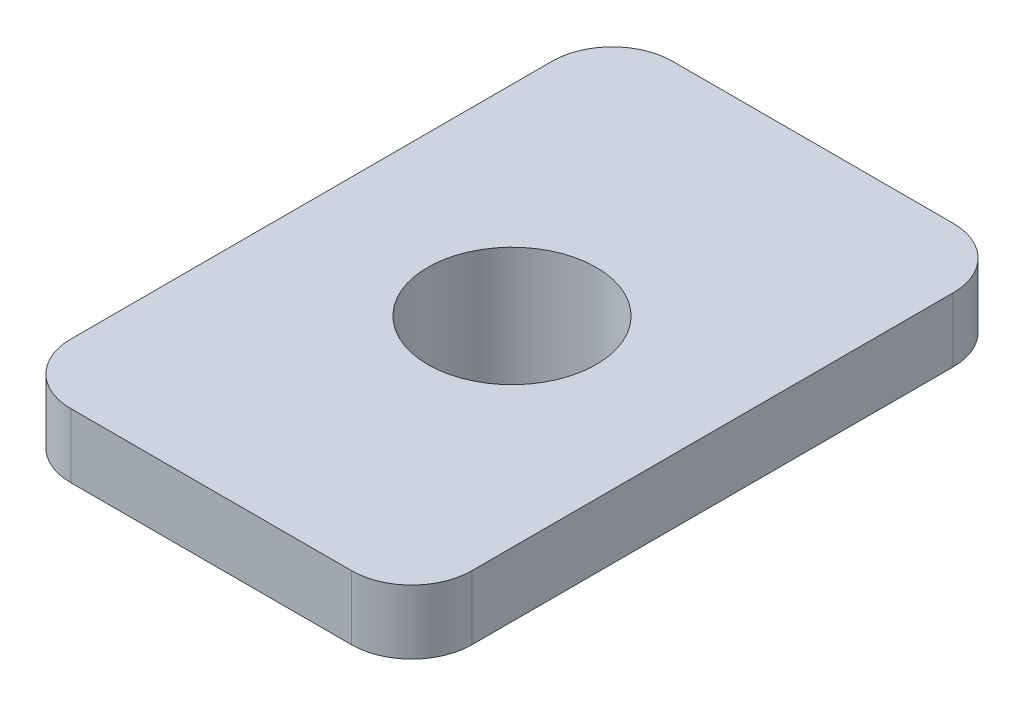
from build123d import *

# Parameters (mm, degrees)
SKETCH1_W             = 10
SKETCH1_H             = 15
BOSS_EXTRUDE1_DEPTH   = 1.6
FILLET1_R             = 1.5
SKETCH2_R             = 3.45
BOSS_EXTRUDE2_DEPTH   = 1.4
M5X0_8_TAPPED_HOLE1_D = 4.2
FILLET2_R             = 0.4


with BuildPart() as part:
    # Sketch1 → Boss-Extrude1 (new body)
    with BuildSketch(Plane(origin=(0, 0, 0), x_dir=(1, 0, 0), z_dir=(0, 1, 0))):
        with Locations((5, 7.5)):
            Rectangle(SKETCH1_W, SKETCH1_H)
    extrude(amount=BOSS_EXTRUDE1_DEPTH)

    # Fillet1
    fillet1_edges = [part.edges().sort_by_distance(p)[0] for p in [
        (0, 0.8, -15),
        (10, 0.8, -15),
        (0, 0.8, 0),
        (10, 0.8, 0),
    ]]
    fillet(fillet1_edges, radius=FILLET1_R)

    # Sketch2 → Boss-Extrude2 (add)
    with BuildSketch(Plane.XZ):
        with Locations((5, -7.5)):
            Circle(SKETCH2_R)
    extrude(amount=BOSS_EXTRUDE2_DEPTH)

    # M5x0.8 Tapped Hole1 (through all)
    with Locations(Plane(origin=(0, 1.6, 0), x_dir=(1, 0, 0), z_dir=(0, 1, 0))):
        with Locations((5, 7.5)):
            Hole(M5X0_8_TAPPED_HOLE1_D / 2)

    # Fillet2
    fillet2_edges = [part.edges().sort_by_distance(p)[0] for p in [
        (1.55, 0, -7.5),
    ]]
    fillet(fillet2_edges, radius=FILLET2_R)


solid = part.part
